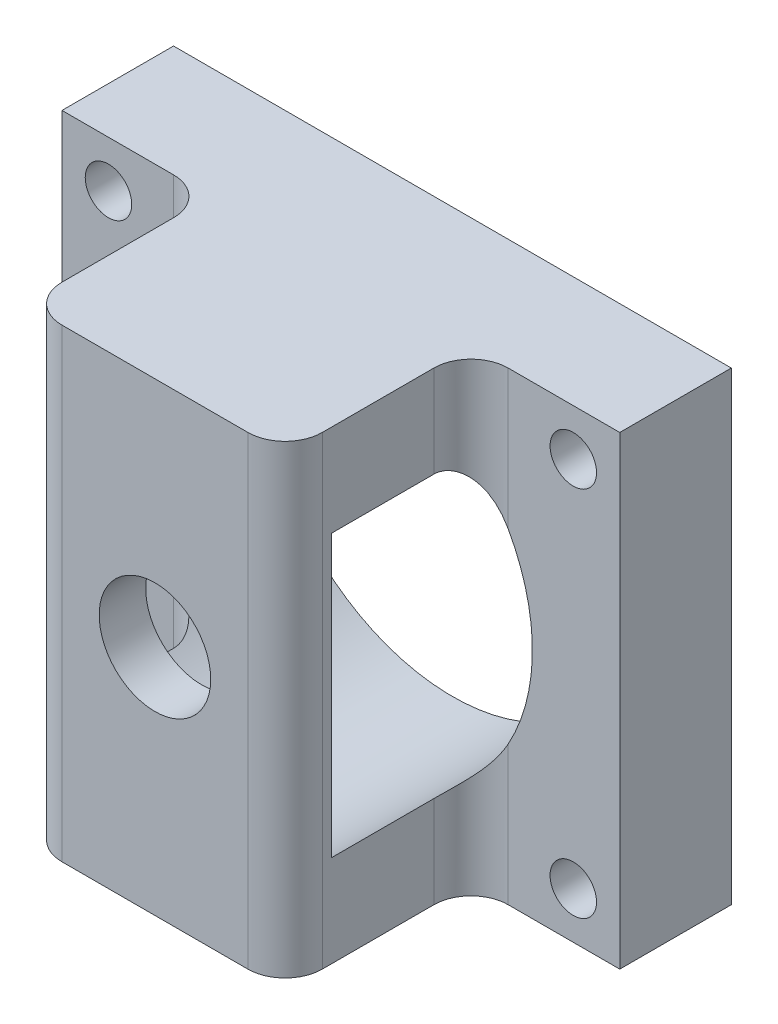
from build123d import *

# Parameters (mm, degrees)
SKETCH1_W          = 30
SKETCH1_H          = 25
SKETCH1_R          = 1.25
SKETCH1_R_2        = 3
MAIN_DEPTH         = 16
SKETCH2_R          = 10.3
CENTRALHOLE_DEPTH  = 13.5
SKETCH5_W          = 8
SKETCH5_H          = 25
CUT_EXTRUDE3_DEPTH = 10
FILLET1_R          = 2


with BuildPart() as part:
    # Sketch1 → Main (new body)
    with BuildSketch(Plane.XY):
        Rectangle(SKETCH1_W, SKETCH1_H)
        with Locations((-12.5, 10)):
            Circle(SKETCH1_R, mode=Mode.SUBTRACT)
        with Locations((12.5, 10)):
            Circle(SKETCH1_R, mode=Mode.SUBTRACT)
        with Locations((-12.5, -10)):
            Circle(SKETCH1_R, mode=Mode.SUBTRACT)
        with Locations((12.5, -10)):
            Circle(SKETCH1_R, mode=Mode.SUBTRACT)
        Circle(SKETCH1_R_2, mode=Mode.SUBTRACT)
    extrude(amount=MAIN_DEPTH)

    # Sketch2 → CentralHole (cut)
    with BuildSketch(Plane.XY):
        Circle(SKETCH2_R)
    extrude(amount=CENTRALHOLE_DEPTH, mode=Mode.SUBTRACT)

    # Sketch5 → Cut-Extrude3 (cut)
    with BuildSketch(Plane.XY.offset(16)):
        with Locations((11, 0)):
            Rectangle(SKETCH5_W, SKETCH5_H)
        with Locations((-11, 0)):
            Rectangle(SKETCH5_W, SKETCH5_H)
    extrude(amount=-CUT_EXTRUDE3_DEPTH, mode=Mode.SUBTRACT)

    # Fillet1
    fillet1_edges = [part.edges().sort_by_distance(p)[0] for p in [
        (-7, 0, 16),
        (7, 0, 16),
        (-7, -10.02789624, 6),
        (-7, 10.02789624, 6),
        (7, 10.02789624, 6),
        (7, -10.02789624, 6),
    ]]
    fillet(fillet1_edges, radius=FILLET1_R)


solid = part.part
